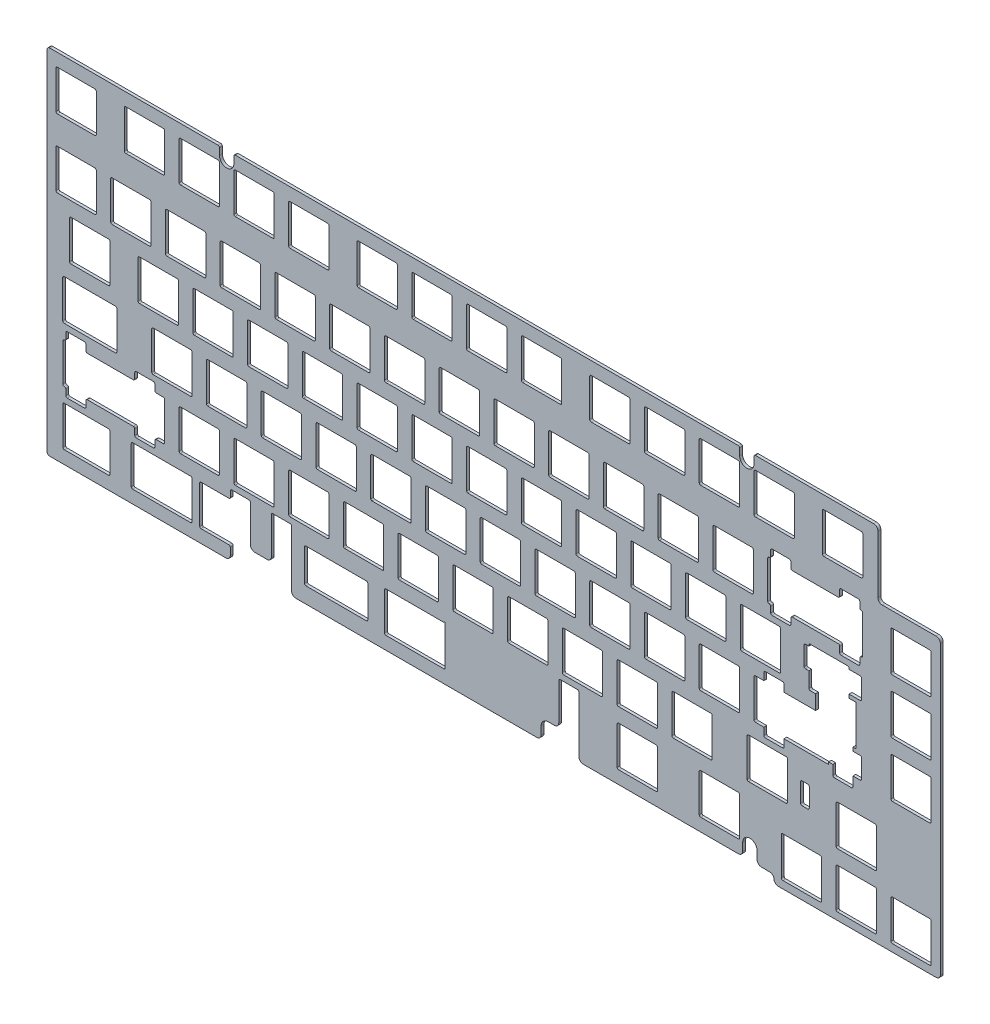
from build123d import *

# Parameters (mm, degrees)
BOSS_EXTRUDE1_DEPTH = 1
CUT_EXTRUDE2_DEPTH  = 1.3
CUT_EXTRUDE1_DEPTH  = 10
FILLET1_R           = 0.5


with BuildPart() as part:
    # Model → Boss-Extrude1 (new body)
    with BuildSketch(Plane.XY):
        with BuildLine():
            ThreePointArc((9.955298424, 130.969514546), (9.177480965, 130.647332005), (8.855298424, 129.869514546))
            Line((8.855298424, 129.869514546), (8.855298424, 63.082014546))
            Line((8.855298424, 63.082014546), (8.855298424, 9.057014546))
            ThreePointArc((8.855298424, 9.057014546), (9.177480965, 8.279197086), (9.955298424, 7.957014546))
            Line((9.955298424, 7.957014546), (71.206983424, 7.957014546))
            ThreePointArc((71.206983424, 7.957014546), (72.267643596, 8.396354374), (72.706983424, 9.457014546))
            Line((72.706983424, 9.457014546), (72.706983424, 11.957014546))
            ThreePointArc((72.706983424, 11.957014546), (72.560536815, 12.310567936), (72.206983424, 12.457014546))
            Line((72.206983424, 12.457014546), (62.559375038, 12.457014546))
            ThreePointArc((62.559375038, 12.457014546), (62.205821647, 12.603461155), (62.059375038, 12.957014546))
            Line((62.059375038, 12.957014546), (62.059375038, 25.957014546))
            ThreePointArc((62.059375038, 25.957014546), (62.205821647, 26.310567936), (62.559375038, 26.457014546))
            Line((62.559375038, 26.457014546), (72.206983424, 26.457014546))
            ThreePointArc((72.206983424, 26.457014546), (72.560536815, 26.603461155), (72.706983424, 26.957014546))
            Line((72.706983424, 26.957014546), (72.706983424, 28.958014546))
            ThreePointArc((72.706983424, 28.958014546), (72.853430033, 29.311567936), (73.206983424, 29.458014546))
            Line((73.206983424, 29.458014546), (79.206983424, 29.458014546))
            ThreePointArc((79.206983424, 29.458014546), (79.560536815, 29.311567936), (79.706983424, 28.958014546))
            Line((79.706983424, 28.958014546), (79.706983424, 16.157014546))
            ThreePointArc((79.706983424, 16.157014546), (80.146323252, 15.096354374), (81.206983424, 14.657014546))
            Line((81.206983424, 14.657014546), (85.495873424, 14.657014546))
            ThreePointArc((85.495873424, 14.657014546), (86.556533596, 15.096354374), (86.995873424, 16.157014546))
            Line((86.995873424, 16.157014546), (86.995873424, 28.958014546))
            ThreePointArc((86.995873424, 28.958014546), (87.142320033, 29.311567936), (87.495873424, 29.458014546))
            Line((87.495873424, 29.458014546), (93.495873424, 29.458014546))
            ThreePointArc((93.495873424, 29.458014546), (93.849426815, 29.311567936), (93.995873424, 28.958014546))
            Line((93.995873424, 28.958014546), (93.995873424, 9.457014546))
            ThreePointArc((93.995873424, 9.457014546), (94.435213252, 8.396354374), (95.495873424, 7.957014546))
            Line((95.495873424, 7.957014546), (179.362538424, 7.957014546))
            ThreePointArc((179.362538424, 7.957014546), (180.423198596, 8.396354374), (180.862538424, 9.457014546))
            Line((180.862538424, 9.457014546), (180.862538424, 12.157014546))
            ThreePointArc((180.862538424, 12.157014546), (181.594771471, 13.924781498), (183.362538424, 14.657014546))
            Line((183.362538424, 14.657014546), (185.495872282, 14.657014546))
            ThreePointArc((185.495872282, 14.657014546), (186.556532454, 15.096354374), (186.995872282, 16.157014546))
            Line((186.995872282, 16.157014546), (186.995872282, 28.958013975))
            ThreePointArc((186.995872282, 28.958013975), (187.14231869, 29.311567734), (187.495872282, 29.458014546))
            Line((187.495872282, 29.458014546), (193.495873424, 29.458014546))
            ThreePointArc((193.495873424, 29.458014546), (193.849426815, 29.311567936), (193.995873424, 28.958014546))
            Line((193.995873424, 28.958014546), (193.995873424, 9.457014546))
            ThreePointArc((193.995873424, 9.457014546), (194.435213252, 8.396354374), (195.495873424, 7.957014546))
            Line((195.495873424, 7.957014546), (249.492798424, 7.957014546))
            ThreePointArc((249.492798424, 7.957014546), (250.553458596, 8.396354374), (250.992798424, 9.457014546))
            Line((250.992798424, 9.457014546), (250.992798424, 12.157014546))
            ThreePointArc((250.992798424, 12.157014546), (253.492798424, 14.657014546), (255.992798424, 12.157014546))
            Line((255.992798424, 12.157014546), (255.992798424, 9.457014546))
            ThreePointArc((255.992798424, 9.457014546), (256.432138252, 8.396354374), (257.492798424, 7.957014546))
            Line((257.492798424, 7.957014546), (260.370951122, 7.957014546))
            ThreePointArc((260.370951122, 7.957014546), (261.407019411, 7.541709203), (261.869374773, 6.525764546))
            ThreePointArc((261.869374773, 6.525764546), (262.331730135, 5.509819888), (263.367798424, 5.094514546))
            Line((263.367798424, 5.094514546), (318.267798424, 5.094514546))
            ThreePointArc((318.267798424, 5.094514546), (319.328458596, 5.533854374), (319.767798424, 6.594514546))
            Line((319.767798424, 6.594514546), (319.767798424, 63.082014546))
            Line((319.767798424, 63.082014546), (319.767798424, 106.45317864))
            ThreePointArc((319.767798424, 106.45317864), (319.328458596, 107.513838812), (318.267798424, 107.95317864))
            Line((318.267798424, 107.95317864), (299.555298424, 107.95317864))
            ThreePointArc((299.555298424, 107.95317864), (298.494638252, 108.392518468), (298.055298424, 109.45317864))
            Line((298.055298424, 109.45317864), (298.055298424, 129.469514546))
            ThreePointArc((298.055298424, 129.469514546), (297.615958596, 130.530174717), (296.555298424, 130.969514546))
            Line((296.555298424, 130.969514546), (256.426800065, 130.969514546))
            Line((256.426800065, 130.969514546), (248.426800065, 130.969514546))
            Line((248.426800065, 130.969514546), (75.451800065, 130.969514546))
            Line((75.451800065, 130.969514546), (67.451800065, 130.969514546))
            Line((67.451800065, 130.969514546), (9.955298424, 130.969514546))
        make_face()
        with BuildLine():
            ThreePointArc((14.934285038, 12.457014546), (14.580731647, 12.603461155), (14.434285038, 12.957014546))
            Line((14.434285038, 12.957014546), (14.434285038, 25.957014546))
            ThreePointArc((14.434285038, 25.957014546), (14.580731647, 26.310567936), (14.934285038, 26.457014546))
            Line((14.934285038, 26.457014546), (30.319483424, 26.457014546))
            ThreePointArc((30.319483424, 26.457014546), (30.673036815, 26.310567936), (30.819483424, 25.957014546))
            Line((30.819483424, 25.957014546), (30.819483424, 12.957014546))
            ThreePointArc((30.819483424, 12.957014546), (30.673036815, 12.603461155), (30.319483424, 12.457014546))
            Line((30.319483424, 12.457014546), (14.934285038, 12.457014546))
        make_face(mode=Mode.SUBTRACT)
        with BuildLine():
            ThreePointArc((38.745375038, 12.457014546), (38.391821647, 12.603461155), (38.245375038, 12.957014546))
            Line((38.245375038, 12.957014546), (38.245375038, 25.957014546))
            ThreePointArc((38.245375038, 25.957014546), (38.391821647, 26.310567936), (38.745375038, 26.457014546))
            Line((38.745375038, 26.457014546), (58.894483424, 26.457014546))
            ThreePointArc((58.894483424, 26.457014546), (59.248036815, 26.310567936), (59.394483424, 25.957014546))
            Line((59.394483424, 25.957014546), (59.394483424, 12.957014546))
            ThreePointArc((59.394483424, 12.957014546), (59.248036815, 12.603461155), (58.894483424, 12.457014546))
            Line((58.894483424, 12.457014546), (38.745375038, 12.457014546))
        make_face(mode=Mode.SUBTRACT)
        with BuildLine():
            Line((120.541283424, 24.957014546), (120.541283424, 13.957014546))
            ThreePointArc((120.541283424, 13.957014546), (120.394836815, 13.603461155), (120.041283424, 13.457014546))
            Line((120.041283424, 13.457014546), (99.041283424, 13.457014546))
            ThreePointArc((99.041283424, 13.457014546), (98.687730033, 13.603461155), (98.541283424, 13.957014546))
            Line((98.541283424, 13.957014546), (98.541283424, 24.957014546))
            ThreePointArc((98.541283424, 24.957014546), (98.687730033, 25.310567936), (99.041283424, 25.457014546))
            Line((99.041283424, 25.457014546), (120.041283424, 25.457014546))
            ThreePointArc((120.041283424, 25.457014546), (120.394836815, 25.310567936), (120.541283424, 24.957014546))
        make_face(mode=Mode.SUBTRACT)
        with BuildLine():
            ThreePointArc((126.856983424, 12.457014546), (126.503430033, 12.603461155), (126.356983424, 12.957014546))
            Line((126.356983424, 12.957014546), (126.356983424, 25.957014546))
            ThreePointArc((126.356983424, 25.957014546), (126.503430033, 26.310567936), (126.856983424, 26.457014546))
            Line((126.856983424, 26.457014546), (146.995875038, 26.457014546))
            ThreePointArc((146.995875038, 26.457014546), (147.192055678, 26.702383251), (147.495875038, 26.782298463))
            Line((147.495875038, 26.782298463), (147.495875038, 12.957014546))
            ThreePointArc((147.495875038, 12.957014546), (147.349428429, 12.603461155), (146.995875038, 12.457014546))
            Line((146.995875038, 12.457014546), (126.856983424, 12.457014546))
        make_face(mode=Mode.SUBTRACT)
        with BuildLine():
            Line((15.463233424, 46.007014546), (15.463233424, 48.007314546))
            ThreePointArc((15.463233424, 48.007314546), (15.609680033, 48.360867936), (15.963233424, 48.507314546))
            Line((15.963233424, 48.507314546), (21.963233424, 48.507314546))
            ThreePointArc((21.963233424, 48.507314546), (22.316786815, 48.360867936), (22.463233424, 48.007314546))
            Line((22.463233424, 48.007314546), (22.463233424, 46.007314546))
            ThreePointArc((22.463233424, 46.007314546), (22.609680033, 45.653761155), (22.963233424, 45.507314546))
            Line((22.963233424, 45.507314546), (38.963233424, 45.507314546))
            ThreePointArc((38.963233424, 45.507314546), (39.316786815, 45.653761155), (39.463233424, 46.007314546))
            Line((39.463233424, 46.007314546), (39.463233424, 48.007314546))
            ThreePointArc((39.463233424, 48.007314546), (39.609680033, 48.360867936), (39.963233424, 48.507314546))
            Line((39.963233424, 48.507314546), (45.963233424, 48.507314546))
            ThreePointArc((45.963233424, 48.507314546), (46.316786815, 48.360867936), (46.463233424, 48.007314546))
            Line((46.463233424, 48.007314546), (46.463233424, 46.007014546))
            ThreePointArc((46.463233424, 46.007014546), (46.609680033, 45.653461155), (46.963233424, 45.507014546))
            Line((46.963233424, 45.507014546), (49.367798424, 45.507014546))
            ThreePointArc((49.367798424, 45.507014546), (49.721351815, 45.360567936), (49.867798424, 45.007014546))
            Line((49.867798424, 45.007014546), (49.867798424, 32.007014546))
            ThreePointArc((49.867798424, 32.007014546), (49.721351815, 31.653461155), (49.367798424, 31.507014546))
            Line((49.367798424, 31.507014546), (46.963233424, 31.507014546))
            ThreePointArc((46.963233424, 31.507014546), (46.609680033, 31.360567936), (46.463233424, 31.007014546))
            Line((46.463233424, 31.007014546), (46.463233424, 29.007314546))
            ThreePointArc((46.463233424, 29.007314546), (46.316786815, 28.653761155), (45.963233424, 28.507314546))
            Line((45.963233424, 28.507314546), (39.963233424, 28.507314546))
            ThreePointArc((39.963233424, 28.507314546), (39.609680033, 28.653761155), (39.463233424, 29.007314546))
            Line((39.463233424, 29.007314546), (39.463233424, 31.007314546))
            ThreePointArc((39.463233424, 31.007314546), (39.316786815, 31.360867936), (38.963233424, 31.507314546))
            Line((38.963233424, 31.507314546), (22.963233424, 31.507314546))
            ThreePointArc((22.963233424, 31.507314546), (22.609680033, 31.360867936), (22.463233424, 31.007314546))
            Line((22.463233424, 31.007314546), (22.463233424, 29.007314546))
            ThreePointArc((22.463233424, 29.007314546), (22.316786815, 28.653761155), (21.963233424, 28.507314546))
            Line((21.963233424, 28.507314546), (15.963233424, 28.507314546))
            ThreePointArc((15.963233424, 28.507314546), (15.609680033, 28.653761155), (15.463233424, 29.007314546))
            Line((15.463233424, 29.007314546), (15.463233424, 31.007014546))
            ThreePointArc((15.463233424, 31.007014546), (15.316786815, 31.360567936), (14.963233424, 31.507014546))
            Line((14.963233424, 31.507014546), (14.936548424, 31.507014546))
            ThreePointArc((14.936548424, 31.507014546), (14.582995033, 31.653461155), (14.436548424, 32.007014546))
            Line((14.436548424, 32.007014546), (14.436548424, 45.007014546))
            ThreePointArc((14.436548424, 45.007014546), (14.582995033, 45.360567936), (14.936548424, 45.507014546))
            Line((14.936548424, 45.507014546), (14.963233424, 45.507014546))
            ThreePointArc((14.963233424, 45.507014546), (15.316786815, 45.653461155), (15.463233424, 46.007014546))
        make_face(mode=Mode.SUBTRACT)
        with BuildLine():
            Line((68.442798424, 31.482014546), (55.392798424, 31.482014546))
            ThreePointArc((55.392798424, 31.482014546), (55.039245033, 31.628461155), (54.892798424, 31.982014546))
            Line((54.892798424, 31.982014546), (54.892798424, 45.032014546))
            ThreePointArc((54.892798424, 45.032014546), (55.039245033, 45.385567936), (55.392798424, 45.532014546))
            Line((55.392798424, 45.532014546), (68.442798424, 45.532014546))
            ThreePointArc((68.442798424, 45.532014546), (68.796351815, 45.385567936), (68.942798424, 45.032014546))
            Line((68.942798424, 45.032014546), (68.942798424, 31.982014546))
            ThreePointArc((68.942798424, 31.982014546), (68.796351815, 31.628461155), (68.442798424, 31.482014546))
        make_face(mode=Mode.SUBTRACT)
        with BuildLine():
            Line((87.492798424, 31.482014546), (74.442798424, 31.482014546))
            ThreePointArc((74.442798424, 31.482014546), (74.089245033, 31.628461155), (73.942798424, 31.982014546))
            Line((73.942798424, 31.982014546), (73.942798424, 45.032014546))
            ThreePointArc((73.942798424, 45.032014546), (74.089245033, 45.385567936), (74.442798424, 45.532014546))
            Line((74.442798424, 45.532014546), (87.492798424, 45.532014546))
            ThreePointArc((87.492798424, 45.532014546), (87.846351815, 45.385567936), (87.992798424, 45.032014546))
            Line((87.992798424, 45.032014546), (87.992798424, 31.982014546))
            ThreePointArc((87.992798424, 31.982014546), (87.846351815, 31.628461155), (87.492798424, 31.482014546))
        make_face(mode=Mode.SUBTRACT)
        with BuildLine():
            ThreePointArc((33.249048424, 51.057014546), (33.087957154, 50.668105816), (32.699048424, 50.507014546))
            Line((32.699048424, 50.507014546), (14.936548424, 50.507014546))
            ThreePointArc((14.936548424, 50.507014546), (14.547639694, 50.668105816), (14.386548424, 51.057014546))
            Line((14.386548424, 51.057014546), (14.386548424, 64.057014546))
            ThreePointArc((14.386548424, 64.057014546), (14.547639694, 64.445923275), (14.936548424, 64.607014546))
            Line((14.936548424, 64.607014546), (32.699048424, 64.607014546))
            ThreePointArc((32.699048424, 64.607014546), (33.087957154, 64.445923275), (33.249048424, 64.057014546))
            Line((33.249048424, 64.057014546), (33.249048424, 51.057014546))
        make_face(mode=Mode.SUBTRACT)
        with BuildLine():
            Line((58.917798424, 50.532014546), (45.867798424, 50.532014546))
            ThreePointArc((45.867798424, 50.532014546), (45.514245033, 50.678461155), (45.367798424, 51.032014546))
            Line((45.367798424, 51.032014546), (45.367798424, 64.082014546))
            ThreePointArc((45.367798424, 64.082014546), (45.514245033, 64.435567936), (45.867798424, 64.582014546))
            Line((45.867798424, 64.582014546), (58.917798424, 64.582014546))
            ThreePointArc((58.917798424, 64.582014546), (59.271351815, 64.435567936), (59.417798424, 64.082014546))
            Line((59.417798424, 64.082014546), (59.417798424, 51.032014546))
            ThreePointArc((59.417798424, 51.032014546), (59.271351815, 50.678461155), (58.917798424, 50.532014546))
        make_face(mode=Mode.SUBTRACT)
        with BuildLine():
            Line((77.967798424, 50.532014546), (64.917798424, 50.532014546))
            ThreePointArc((64.917798424, 50.532014546), (64.564245033, 50.678461155), (64.417798424, 51.032014546))
            Line((64.417798424, 51.032014546), (64.417798424, 64.082014546))
            ThreePointArc((64.417798424, 64.082014546), (64.564245033, 64.435567936), (64.917798424, 64.582014546))
            Line((64.917798424, 64.582014546), (77.967798424, 64.582014546))
            ThreePointArc((77.967798424, 64.582014546), (78.321351815, 64.435567936), (78.467798424, 64.082014546))
            Line((78.467798424, 64.082014546), (78.467798424, 51.032014546))
            ThreePointArc((78.467798424, 51.032014546), (78.321351815, 50.678461155), (77.967798424, 50.532014546))
        make_face(mode=Mode.SUBTRACT)
        with BuildLine():
            Line((106.542798424, 31.482014546), (93.492798424, 31.482014546))
            ThreePointArc((93.492798424, 31.482014546), (93.139245033, 31.628461155), (92.992798424, 31.982014546))
            Line((92.992798424, 31.982014546), (92.992798424, 45.032014546))
            ThreePointArc((92.992798424, 45.032014546), (93.139245033, 45.385567936), (93.492798424, 45.532014546))
            Line((93.492798424, 45.532014546), (106.542798424, 45.532014546))
            ThreePointArc((106.542798424, 45.532014546), (106.896351815, 45.385567936), (107.042798424, 45.032014546))
            Line((107.042798424, 45.032014546), (107.042798424, 31.982014546))
            ThreePointArc((107.042798424, 31.982014546), (106.896351815, 31.628461155), (106.542798424, 31.482014546))
        make_face(mode=Mode.SUBTRACT)
        with BuildLine():
            Line((125.592798424, 31.482014546), (112.542798424, 31.482014546))
            ThreePointArc((112.542798424, 31.482014546), (112.189245033, 31.628461155), (112.042798424, 31.982014546))
            Line((112.042798424, 31.982014546), (112.042798424, 45.032014546))
            ThreePointArc((112.042798424, 45.032014546), (112.189245033, 45.385567936), (112.542798424, 45.532014546))
            Line((112.542798424, 45.532014546), (125.592798424, 45.532014546))
            ThreePointArc((125.592798424, 45.532014546), (125.946351815, 45.385567936), (126.092798424, 45.032014546))
            Line((126.092798424, 45.032014546), (126.092798424, 31.982014546))
            ThreePointArc((126.092798424, 31.982014546), (125.946351815, 31.628461155), (125.592798424, 31.482014546))
        make_face(mode=Mode.SUBTRACT)
        with BuildLine():
            Line((144.642798424, 31.482014546), (131.592798424, 31.482014546))
            ThreePointArc((131.592798424, 31.482014546), (131.239245033, 31.628461155), (131.092798424, 31.982014546))
            Line((131.092798424, 31.982014546), (131.092798424, 45.032014546))
            ThreePointArc((131.092798424, 45.032014546), (131.239245033, 45.385567936), (131.592798424, 45.532014546))
            Line((131.592798424, 45.532014546), (144.642798424, 45.532014546))
            ThreePointArc((144.642798424, 45.532014546), (144.996351815, 45.385567936), (145.142798424, 45.032014546))
            Line((145.142798424, 45.032014546), (145.142798424, 31.982014546))
            ThreePointArc((145.142798424, 31.982014546), (144.996351815, 31.628461155), (144.642798424, 31.482014546))
        make_face(mode=Mode.SUBTRACT)
        with BuildLine():
            Line((163.692798424, 31.482014546), (150.642798424, 31.482014546))
            ThreePointArc((150.642798424, 31.482014546), (150.289245033, 31.628461155), (150.142798424, 31.982014546))
            Line((150.142798424, 31.982014546), (150.142798424, 45.032014546))
            ThreePointArc((150.142798424, 45.032014546), (150.289245033, 45.385567936), (150.642798424, 45.532014546))
            Line((150.642798424, 45.532014546), (163.692798424, 45.532014546))
            ThreePointArc((163.692798424, 45.532014546), (164.046351815, 45.385567936), (164.192798424, 45.032014546))
            Line((164.192798424, 45.032014546), (164.192798424, 31.982014546))
            ThreePointArc((164.192798424, 31.982014546), (164.046351815, 31.628461155), (163.692798424, 31.482014546))
        make_face(mode=Mode.SUBTRACT)
        with BuildLine():
            Line((97.017798424, 50.532014546), (83.967798424, 50.532014546))
            ThreePointArc((83.967798424, 50.532014546), (83.614245033, 50.678461155), (83.467798424, 51.032014546))
            Line((83.467798424, 51.032014546), (83.467798424, 64.082014546))
            ThreePointArc((83.467798424, 64.082014546), (83.614245033, 64.435567936), (83.967798424, 64.582014546))
            Line((83.967798424, 64.582014546), (97.017798424, 64.582014546))
            ThreePointArc((97.017798424, 64.582014546), (97.371351815, 64.435567936), (97.517798424, 64.082014546))
            Line((97.517798424, 64.082014546), (97.517798424, 51.032014546))
            ThreePointArc((97.517798424, 51.032014546), (97.371351815, 50.678461155), (97.017798424, 50.532014546))
        make_face(mode=Mode.SUBTRACT)
        with BuildLine():
            Line((116.067798424, 50.532014546), (103.017798424, 50.532014546))
            ThreePointArc((103.017798424, 50.532014546), (102.664245033, 50.678461155), (102.517798424, 51.032014546))
            Line((102.517798424, 51.032014546), (102.517798424, 64.082014546))
            ThreePointArc((102.517798424, 64.082014546), (102.664245033, 64.435567936), (103.017798424, 64.582014546))
            Line((103.017798424, 64.582014546), (116.067798424, 64.582014546))
            ThreePointArc((116.067798424, 64.582014546), (116.421351815, 64.435567936), (116.567798424, 64.082014546))
            Line((116.567798424, 64.082014546), (116.567798424, 51.032014546))
            ThreePointArc((116.567798424, 51.032014546), (116.421351815, 50.678461155), (116.067798424, 50.532014546))
        make_face(mode=Mode.SUBTRACT)
        with BuildLine():
            Line((135.117798424, 50.532014546), (122.067798424, 50.532014546))
            ThreePointArc((122.067798424, 50.532014546), (121.714245033, 50.678461155), (121.567798424, 51.032014546))
            Line((121.567798424, 51.032014546), (121.567798424, 64.082014546))
            ThreePointArc((121.567798424, 64.082014546), (121.714245033, 64.435567936), (122.067798424, 64.582014546))
            Line((122.067798424, 64.582014546), (135.117798424, 64.582014546))
            ThreePointArc((135.117798424, 64.582014546), (135.471351815, 64.435567936), (135.617798424, 64.082014546))
            Line((135.617798424, 64.082014546), (135.617798424, 51.032014546))
            ThreePointArc((135.617798424, 51.032014546), (135.471351815, 50.678461155), (135.117798424, 50.532014546))
        make_face(mode=Mode.SUBTRACT)
        with BuildLine():
            Line((154.167798424, 50.532014546), (141.117798424, 50.532014546))
            ThreePointArc((141.117798424, 50.532014546), (140.764245033, 50.678461155), (140.617798424, 51.032014546))
            Line((140.617798424, 51.032014546), (140.617798424, 64.082014546))
            ThreePointArc((140.617798424, 64.082014546), (140.764245033, 64.435567936), (141.117798424, 64.582014546))
            Line((141.117798424, 64.582014546), (154.167798424, 64.582014546))
            ThreePointArc((154.167798424, 64.582014546), (154.521351815, 64.435567936), (154.667798424, 64.082014546))
            Line((154.667798424, 64.082014546), (154.667798424, 51.032014546))
            ThreePointArc((154.667798424, 51.032014546), (154.521351815, 50.678461155), (154.167798424, 50.532014546))
        make_face(mode=Mode.SUBTRACT)
        with BuildLine():
            Line((220.842798424, 12.432014546), (207.792798424, 12.432014546))
            ThreePointArc((207.792798424, 12.432014546), (207.439245033, 12.578461155), (207.292798424, 12.932014546))
            Line((207.292798424, 12.932014546), (207.292798424, 25.982014546))
            ThreePointArc((207.292798424, 25.982014546), (207.439245033, 26.335567936), (207.792798424, 26.482014546))
            Line((207.792798424, 26.482014546), (220.842798424, 26.482014546))
            ThreePointArc((220.842798424, 26.482014546), (221.196351815, 26.335567936), (221.342798424, 25.982014546))
            Line((221.342798424, 25.982014546), (221.342798424, 12.932014546))
            ThreePointArc((221.342798424, 12.932014546), (221.196351815, 12.578461155), (220.842798424, 12.432014546))
        make_face(mode=Mode.SUBTRACT)
        with BuildLine():
            Line((249.417798424, 12.432014546), (236.367798424, 12.432014546))
            ThreePointArc((236.367798424, 12.432014546), (236.014245033, 12.578461155), (235.867798424, 12.932014546))
            Line((235.867798424, 12.932014546), (235.867798424, 25.982014546))
            ThreePointArc((235.867798424, 25.982014546), (236.014245033, 26.335567936), (236.367798424, 26.482014546))
            Line((236.367798424, 26.482014546), (249.417798424, 26.482014546))
            ThreePointArc((249.417798424, 26.482014546), (249.771351815, 26.335567936), (249.917798424, 25.982014546))
            Line((249.917798424, 25.982014546), (249.917798424, 12.932014546))
            ThreePointArc((249.917798424, 12.932014546), (249.771351815, 12.578461155), (249.417798424, 12.432014546))
        make_face(mode=Mode.SUBTRACT)
        with BuildLine():
            Line((277.992798424, 7.669514546), (264.942798424, 7.669514546))
            ThreePointArc((264.942798424, 7.669514546), (264.589245033, 7.815961155), (264.442798424, 8.169514546))
            Line((264.442798424, 8.169514546), (264.442798424, 21.219514546))
            ThreePointArc((264.442798424, 21.219514546), (264.589245033, 21.573067936), (264.942798424, 21.719514546))
            Line((264.942798424, 21.719514546), (277.992798424, 21.719514546))
            ThreePointArc((277.992798424, 21.719514546), (278.346351815, 21.573067936), (278.492798424, 21.219514546))
            Line((278.492798424, 21.219514546), (278.492798424, 8.169514546))
            ThreePointArc((278.492798424, 8.169514546), (278.346351815, 7.815961155), (277.992798424, 7.669514546))
        make_face(mode=Mode.SUBTRACT)
        with BuildLine():
            Line((297.042798424, 7.669514546), (283.992798424, 7.669514546))
            ThreePointArc((283.992798424, 7.669514546), (283.639245033, 7.815961155), (283.492798424, 8.169514546))
            Line((283.492798424, 8.169514546), (283.492798424, 21.219514546))
            ThreePointArc((283.492798424, 21.219514546), (283.639245033, 21.573067936), (283.992798424, 21.719514546))
            Line((283.992798424, 21.719514546), (297.042798424, 21.719514546))
            ThreePointArc((297.042798424, 21.719514546), (297.396351815, 21.573067936), (297.542798424, 21.219514546))
            Line((297.542798424, 21.219514546), (297.542798424, 8.169514546))
            ThreePointArc((297.542798424, 8.169514546), (297.396351815, 7.815961155), (297.042798424, 7.669514546))
        make_face(mode=Mode.SUBTRACT)
        with BuildLine():
            Line((316.092798424, 7.669514546), (303.042798424, 7.669514546))
            ThreePointArc((303.042798424, 7.669514546), (302.689245033, 7.815961155), (302.542798424, 8.169514546))
            Line((302.542798424, 8.169514546), (302.542798424, 21.219514546))
            ThreePointArc((302.542798424, 21.219514546), (302.689245033, 21.573067936), (303.042798424, 21.719514546))
            Line((303.042798424, 21.719514546), (316.092798424, 21.719514546))
            ThreePointArc((316.092798424, 21.719514546), (316.446351815, 21.573067936), (316.592798424, 21.219514546))
            Line((316.592798424, 21.219514546), (316.592798424, 8.169514546))
            ThreePointArc((316.592798424, 8.169514546), (316.446351815, 7.815961155), (316.092798424, 7.669514546))
        make_face(mode=Mode.SUBTRACT)
        with BuildLine():
            Line((297.042798424, 26.719514546), (283.992798424, 26.719514546))
            ThreePointArc((283.992798424, 26.719514546), (283.639245033, 26.865961155), (283.492798424, 27.219514546))
            Line((283.492798424, 27.219514546), (283.492798424, 40.269514546))
            ThreePointArc((283.492798424, 40.269514546), (283.639245033, 40.623067936), (283.992798424, 40.769514546))
            Line((283.992798424, 40.769514546), (297.042798424, 40.769514546))
            ThreePointArc((297.042798424, 40.769514546), (297.396351815, 40.623067936), (297.542798424, 40.269514546))
            Line((297.542798424, 40.269514546), (297.542798424, 27.219514546))
            ThreePointArc((297.542798424, 27.219514546), (297.396351815, 26.865961155), (297.042798424, 26.719514546))
        make_face(mode=Mode.SUBTRACT)
        with BuildLine():
            Line((182.742798424, 31.482014546), (169.692798424, 31.482014546))
            ThreePointArc((169.692798424, 31.482014546), (169.339245033, 31.628461155), (169.192798424, 31.982014546))
            Line((169.192798424, 31.982014546), (169.192798424, 45.032014546))
            ThreePointArc((169.192798424, 45.032014546), (169.339245033, 45.385567936), (169.692798424, 45.532014546))
            Line((169.692798424, 45.532014546), (182.742798424, 45.532014546))
            ThreePointArc((182.742798424, 45.532014546), (183.096351815, 45.385567936), (183.242798424, 45.032014546))
            Line((183.242798424, 45.032014546), (183.242798424, 31.982014546))
            ThreePointArc((183.242798424, 31.982014546), (183.096351815, 31.628461155), (182.742798424, 31.482014546))
        make_face(mode=Mode.SUBTRACT)
        with BuildLine():
            Line((201.792798424, 31.482014546), (188.742798424, 31.482014546))
            ThreePointArc((188.742798424, 31.482014546), (188.389245033, 31.628461155), (188.242798424, 31.982014546))
            Line((188.242798424, 31.982014546), (188.242798424, 45.032014546))
            ThreePointArc((188.242798424, 45.032014546), (188.389245033, 45.385567936), (188.742798424, 45.532014546))
            Line((188.742798424, 45.532014546), (201.792798424, 45.532014546))
            ThreePointArc((201.792798424, 45.532014546), (202.146351815, 45.385567936), (202.292798424, 45.032014546))
            Line((202.292798424, 45.032014546), (202.292798424, 31.982014546))
            ThreePointArc((202.292798424, 31.982014546), (202.146351815, 31.628461155), (201.792798424, 31.482014546))
        make_face(mode=Mode.SUBTRACT)
        with BuildLine():
            Line((220.842798424, 31.482014546), (207.792798424, 31.482014546))
            ThreePointArc((207.792798424, 31.482014546), (207.439245033, 31.628461155), (207.292798424, 31.982014546))
            Line((207.292798424, 31.982014546), (207.292798424, 45.032014546))
            ThreePointArc((207.292798424, 45.032014546), (207.439245033, 45.385567936), (207.792798424, 45.532014546))
            Line((207.792798424, 45.532014546), (220.842798424, 45.532014546))
            ThreePointArc((220.842798424, 45.532014546), (221.196351815, 45.385567936), (221.342798424, 45.032014546))
            Line((221.342798424, 45.032014546), (221.342798424, 31.982014546))
            ThreePointArc((221.342798424, 31.982014546), (221.196351815, 31.628461155), (220.842798424, 31.482014546))
        make_face(mode=Mode.SUBTRACT)
        with BuildLine():
            Line((239.892798424, 31.482014546), (226.842798424, 31.482014546))
            ThreePointArc((226.842798424, 31.482014546), (226.489245033, 31.628461155), (226.342798424, 31.982014546))
            Line((226.342798424, 31.982014546), (226.342798424, 45.032014546))
            ThreePointArc((226.342798424, 45.032014546), (226.489245033, 45.385567936), (226.842798424, 45.532014546))
            Line((226.842798424, 45.532014546), (239.892798424, 45.532014546))
            ThreePointArc((239.892798424, 45.532014546), (240.246351815, 45.385567936), (240.392798424, 45.032014546))
            Line((240.392798424, 45.032014546), (240.392798424, 31.982014546))
            ThreePointArc((240.392798424, 31.982014546), (240.246351815, 31.628461155), (239.892798424, 31.482014546))
        make_face(mode=Mode.SUBTRACT)
        with BuildLine():
            Line((173.217798424, 50.532014546), (160.167798424, 50.532014546))
            ThreePointArc((160.167798424, 50.532014546), (159.814245033, 50.678461155), (159.667798424, 51.032014546))
            Line((159.667798424, 51.032014546), (159.667798424, 64.082014546))
            ThreePointArc((159.667798424, 64.082014546), (159.814245033, 64.435567936), (160.167798424, 64.582014546))
            Line((160.167798424, 64.582014546), (173.217798424, 64.582014546))
            ThreePointArc((173.217798424, 64.582014546), (173.571351815, 64.435567936), (173.717798424, 64.082014546))
            Line((173.717798424, 64.082014546), (173.717798424, 51.032014546))
            ThreePointArc((173.717798424, 51.032014546), (173.571351815, 50.678461155), (173.217798424, 50.532014546))
        make_face(mode=Mode.SUBTRACT)
        with BuildLine():
            Line((192.267798424, 50.532014546), (179.217798424, 50.532014546))
            ThreePointArc((179.217798424, 50.532014546), (178.864245033, 50.678461155), (178.717798424, 51.032014546))
            Line((178.717798424, 51.032014546), (178.717798424, 64.082014546))
            ThreePointArc((178.717798424, 64.082014546), (178.864245033, 64.435567936), (179.217798424, 64.582014546))
            Line((179.217798424, 64.582014546), (192.267798424, 64.582014546))
            ThreePointArc((192.267798424, 64.582014546), (192.621351815, 64.435567936), (192.767798424, 64.082014546))
            Line((192.767798424, 64.082014546), (192.767798424, 51.032014546))
            ThreePointArc((192.767798424, 51.032014546), (192.621351815, 50.678461155), (192.267798424, 50.532014546))
        make_face(mode=Mode.SUBTRACT)
        with BuildLine():
            Line((211.317798424, 50.532014546), (198.267798424, 50.532014546))
            ThreePointArc((198.267798424, 50.532014546), (197.914245033, 50.678461155), (197.767798424, 51.032014546))
            Line((197.767798424, 51.032014546), (197.767798424, 64.082014546))
            ThreePointArc((197.767798424, 64.082014546), (197.914245033, 64.435567936), (198.267798424, 64.582014546))
            Line((198.267798424, 64.582014546), (211.317798424, 64.582014546))
            ThreePointArc((211.317798424, 64.582014546), (211.671351815, 64.435567936), (211.817798424, 64.082014546))
            Line((211.817798424, 64.082014546), (211.817798424, 51.032014546))
            ThreePointArc((211.817798424, 51.032014546), (211.671351815, 50.678461155), (211.317798424, 50.532014546))
        make_face(mode=Mode.SUBTRACT)
        with BuildLine():
            Line((230.367798424, 50.532014546), (217.317798424, 50.532014546))
            ThreePointArc((217.317798424, 50.532014546), (216.964245033, 50.678461155), (216.817798424, 51.032014546))
            Line((216.817798424, 51.032014546), (216.817798424, 64.082014546))
            ThreePointArc((216.817798424, 64.082014546), (216.964245033, 64.435567936), (217.317798424, 64.582014546))
            Line((217.317798424, 64.582014546), (230.367798424, 64.582014546))
            ThreePointArc((230.367798424, 64.582014546), (230.721351815, 64.435567936), (230.867798424, 64.082014546))
            Line((230.867798424, 64.082014546), (230.867798424, 51.032014546))
            ThreePointArc((230.867798424, 51.032014546), (230.721351815, 50.678461155), (230.367798424, 50.532014546))
        make_face(mode=Mode.SUBTRACT)
        with BuildLine():
            Line((266.086548424, 31.482014546), (253.036548424, 31.482014546))
            ThreePointArc((253.036548424, 31.482014546), (252.682995033, 31.628461155), (252.536548424, 31.982014546))
            Line((252.536548424, 31.982014546), (252.536548424, 45.032014546))
            ThreePointArc((252.536548424, 45.032014546), (252.682995033, 45.385567936), (253.036548424, 45.532014546))
            Line((253.036548424, 45.532014546), (266.086548424, 45.532014546))
            ThreePointArc((266.086548424, 45.532014546), (266.440101815, 45.385567936), (266.586548424, 45.032014546))
            Line((266.586548424, 45.032014546), (266.586548424, 31.982014546))
            ThreePointArc((266.586548424, 31.982014546), (266.440101815, 31.628461155), (266.086548424, 31.482014546))
        make_face(mode=Mode.SUBTRACT)
        with BuildLine():
            ThreePointArc((271.157173424, 40.507014546), (271.303620033, 40.860567936), (271.657173424, 41.007014546))
            Line((271.657173424, 41.007014546), (273.657173424, 41.007014546))
            ThreePointArc((273.657173424, 41.007014546), (274.010726815, 40.860567936), (274.157173424, 40.507014546))
            Line((274.157173424, 40.507014546), (274.157173424, 36.507014546))
            ThreePointArc((274.157173424, 36.507014546), (274.010726815, 36.153461155), (273.657173424, 36.007014546))
            Line((273.657173424, 36.007014546), (271.657173424, 36.007014546))
            ThreePointArc((271.657173424, 36.007014546), (271.303620033, 36.153461155), (271.157173424, 36.507014546))
            Line((271.157173424, 36.507014546), (271.157173424, 40.507014546))
        make_face(mode=Mode.SUBTRACT)
        with BuildLine():
            Line((249.417798424, 50.532014546), (236.367798424, 50.532014546))
            ThreePointArc((236.367798424, 50.532014546), (236.014245033, 50.678461155), (235.867798424, 51.032014546))
            Line((235.867798424, 51.032014546), (235.867798424, 64.082014546))
            ThreePointArc((235.867798424, 64.082014546), (236.014245033, 64.435567936), (236.367798424, 64.582014546))
            Line((236.367798424, 64.582014546), (249.417798424, 64.582014546))
            ThreePointArc((249.417798424, 64.582014546), (249.771351815, 64.435567936), (249.917798424, 64.082014546))
            Line((249.917798424, 64.082014546), (249.917798424, 51.032014546))
            ThreePointArc((249.917798424, 51.032014546), (249.771351815, 50.678461155), (249.417798424, 50.532014546))
        make_face(mode=Mode.SUBTRACT)
        with BuildLine():
            ThreePointArc((273.992798424, 83.107014546), (274.139245033, 83.460567936), (274.492798424, 83.607014546))
            Line((274.492798424, 83.607014546), (287.492798424, 83.607014546))
            ThreePointArc((287.492798424, 83.607014546), (287.846351815, 83.460567936), (287.992798424, 83.107014546))
            Line((287.992798424, 83.107014546), (287.995298424, 82.780068193))
            Line((287.995298424, 82.780068193), (291.850783424, 82.780068193))
            ThreePointArc((291.850783424, 82.780068193), (292.204336815, 82.633621584), (292.350783424, 82.280068193))
            Line((292.350783424, 82.280068193), (292.350783424, 75.842068193))
            ThreePointArc((292.350783424, 75.842068193), (292.204336815, 75.488514803), (291.850783424, 75.342068193))
            Line((291.850783424, 75.342068193), (287.995298424, 75.342068193))
            Line((287.995298424, 75.342068193), (287.995298424, 74.061068193))
            Line((287.995298424, 74.061068193), (290.376548424, 74.061068193))
            Line((290.376548424, 74.061068193), (290.376548424, 60.061068193))
            Line((290.376548424, 60.061068193), (289.350783424, 60.061068193))
            Line((289.350783424, 60.061068193), (289.350783424, 58.780068193))
            Line((289.350783424, 58.780068193), (291.850783424, 58.780068193))
            ThreePointArc((291.850783424, 58.780068193), (292.204336815, 58.633621584), (292.350783424, 58.280068193))
            Line((292.350783424, 58.280068193), (292.350783424, 51.842068193))
            ThreePointArc((292.350783424, 51.842068193), (292.204336815, 51.488514803), (291.850783424, 51.342068193))
            Line((291.850783424, 51.342068193), (289.350783424, 51.342068193))
            Line((289.350783424, 51.342068193), (289.350783424, 48.057014546))
            ThreePointArc((289.350783424, 48.057014546), (289.204336815, 47.703461155), (288.850783424, 47.557014546))
            Line((288.850783424, 47.557014546), (282.850783424, 47.557014546))
            ThreePointArc((282.850783424, 47.557014546), (282.497230033, 47.703461155), (282.350783424, 48.057014546))
            Line((282.350783424, 48.057014546), (282.350783424, 51.342068193))
            Line((282.350783424, 51.342068193), (280.851598424, 51.342068193))
            Line((280.851598424, 51.342068193), (280.851598424, 50.557014546))
            Line((280.851598424, 50.557014546), (265.350783424, 50.557014546))
            Line((265.350783424, 50.557014546), (265.350783424, 48.057014546))
            ThreePointArc((265.350783424, 48.057014546), (265.204336815, 47.703461155), (264.850783424, 47.557014546))
            Line((264.850783424, 47.557014546), (258.850783424, 47.557014546))
            ThreePointArc((258.850783424, 47.557014546), (258.497230033, 47.703461155), (258.350783424, 48.057014546))
            Line((258.350783424, 48.057014546), (258.350783424, 50.557014546))
            Line((258.350783424, 50.557014546), (255.445298424, 50.557014546))
            ThreePointArc((255.445298424, 50.557014546), (255.091745033, 50.703461155), (254.945298424, 51.057014546))
            Line((254.945298424, 51.057014546), (254.945298424, 64.057014546))
            ThreePointArc((254.945298424, 64.057014546), (255.091745033, 64.410567936), (255.445298424, 64.557014546))
            Line((255.445298424, 64.557014546), (258.350783424, 64.557014546))
            Line((258.350783424, 64.557014546), (258.350783424, 67.057014546))
            ThreePointArc((258.350783424, 67.057014546), (258.497230033, 67.410567936), (258.850783424, 67.557014546))
            Line((258.850783424, 67.557014546), (264.850783424, 67.557014546))
            ThreePointArc((264.850783424, 67.557014546), (265.204336815, 67.410567936), (265.350783424, 67.057014546))
            Line((265.350783424, 67.057014546), (265.350783424, 64.557014546))
            Line((265.350783424, 64.557014546), (276.376548424, 64.557014546))
            Line((276.376548424, 64.557014546), (276.376548424, 69.607014546))
            Line((276.376548424, 69.607014546), (274.492798424, 69.607014546))
            ThreePointArc((274.492798424, 69.607014546), (274.139245033, 69.753461155), (273.992798424, 70.107014546))
            Line((273.992798424, 70.107014546), (273.992798424, 75.342068193))
            Line((273.992798424, 75.342068193), (272.850783424, 75.342068193))
            ThreePointArc((272.850783424, 75.342068193), (272.497230033, 75.488514803), (272.350783424, 75.842068193))
            Line((272.350783424, 75.842068193), (272.350783424, 82.280068193))
            ThreePointArc((272.350783424, 82.280068193), (272.497230033, 82.633621584), (272.850783424, 82.780068193))
            Line((272.850783424, 82.780068193), (273.992798424, 82.780068193))
            Line((273.992798424, 82.780068193), (273.992798424, 83.107014546))
        make_face(mode=Mode.SUBTRACT)
        with BuildLine():
            ThreePointArc((302.542798424, 64.057014546), (302.696567364, 64.428245606), (303.067798424, 64.582014546))
            Line((303.067798424, 64.582014546), (316.117798424, 64.582014546))
            ThreePointArc((316.117798424, 64.582014546), (316.453674145, 64.442890267), (316.592798424, 64.107014546))
            Line((316.592798424, 64.107014546), (316.592798424, 51.057014546))
            ThreePointArc((316.592798424, 51.057014546), (316.439029484, 50.685783485), (316.067798424, 50.532014546))
            Line((316.067798424, 50.532014546), (303.067798424, 50.532014546))
            ThreePointArc((303.067798424, 50.532014546), (302.696567364, 50.685783485), (302.542798424, 51.057014546))
            Line((302.542798424, 51.057014546), (302.542798424, 64.057014546))
        make_face(mode=Mode.SUBTRACT)
        with BuildLine():
            Line((30.342798424, 69.582014546), (17.292798424, 69.582014546))
            ThreePointArc((17.292798424, 69.582014546), (16.939245033, 69.728461155), (16.792798424, 70.082014546))
            Line((16.792798424, 70.082014546), (16.792798424, 83.132014546))
            ThreePointArc((16.792798424, 83.132014546), (16.939245033, 83.485567936), (17.292798424, 83.632014546))
            Line((17.292798424, 83.632014546), (30.342798424, 83.632014546))
            ThreePointArc((30.342798424, 83.632014546), (30.696351815, 83.485567936), (30.842798424, 83.132014546))
            Line((30.842798424, 83.132014546), (30.842798424, 70.082014546))
            ThreePointArc((30.842798424, 70.082014546), (30.696351815, 69.728461155), (30.342798424, 69.582014546))
        make_face(mode=Mode.SUBTRACT)
        with BuildLine():
            Line((54.155298424, 69.582014546), (41.105298424, 69.582014546))
            ThreePointArc((41.105298424, 69.582014546), (40.751745033, 69.728461155), (40.605298424, 70.082014546))
            Line((40.605298424, 70.082014546), (40.605298424, 83.132014546))
            ThreePointArc((40.605298424, 83.132014546), (40.751745033, 83.485567936), (41.105298424, 83.632014546))
            Line((41.105298424, 83.632014546), (54.155298424, 83.632014546))
            ThreePointArc((54.155298424, 83.632014546), (54.508851815, 83.485567936), (54.655298424, 83.132014546))
            Line((54.655298424, 83.132014546), (54.655298424, 70.082014546))
            ThreePointArc((54.655298424, 70.082014546), (54.508851815, 69.728461155), (54.155298424, 69.582014546))
        make_face(mode=Mode.SUBTRACT)
        with BuildLine():
            Line((73.205298424, 69.582014546), (60.155298424, 69.582014546))
            ThreePointArc((60.155298424, 69.582014546), (59.801745033, 69.728461155), (59.655298424, 70.082014546))
            Line((59.655298424, 70.082014546), (59.655298424, 83.132014546))
            ThreePointArc((59.655298424, 83.132014546), (59.801745033, 83.485567936), (60.155298424, 83.632014546))
            Line((60.155298424, 83.632014546), (73.205298424, 83.632014546))
            ThreePointArc((73.205298424, 83.632014546), (73.558851815, 83.485567936), (73.705298424, 83.132014546))
            Line((73.705298424, 83.132014546), (73.705298424, 70.082014546))
            ThreePointArc((73.705298424, 70.082014546), (73.558851815, 69.728461155), (73.205298424, 69.582014546))
        make_face(mode=Mode.SUBTRACT)
        with BuildLine():
            Line((92.255298424, 69.582014546), (79.205298424, 69.582014546))
            ThreePointArc((79.205298424, 69.582014546), (78.851745033, 69.728461155), (78.705298424, 70.082014546))
            Line((78.705298424, 70.082014546), (78.705298424, 83.132014546))
            ThreePointArc((78.705298424, 83.132014546), (78.851745033, 83.485567936), (79.205298424, 83.632014546))
            Line((79.205298424, 83.632014546), (92.255298424, 83.632014546))
            ThreePointArc((92.255298424, 83.632014546), (92.608851815, 83.485567936), (92.755298424, 83.132014546))
            Line((92.755298424, 83.132014546), (92.755298424, 70.082014546))
            ThreePointArc((92.755298424, 70.082014546), (92.608851815, 69.728461155), (92.255298424, 69.582014546))
        make_face(mode=Mode.SUBTRACT)
        with BuildLine():
            Line((25.580298424, 88.632014546), (12.530298424, 88.632014546))
            ThreePointArc((12.530298424, 88.632014546), (12.176745033, 88.778461155), (12.030298424, 89.132014546))
            Line((12.030298424, 89.132014546), (12.030298424, 102.182014546))
            ThreePointArc((12.030298424, 102.182014546), (12.176745033, 102.535567936), (12.530298424, 102.682014546))
            Line((12.530298424, 102.682014546), (25.580298424, 102.682014546))
            ThreePointArc((25.580298424, 102.682014546), (25.933851815, 102.535567936), (26.080298424, 102.182014546))
            Line((26.080298424, 102.182014546), (26.080298424, 89.132014546))
            ThreePointArc((26.080298424, 89.132014546), (25.933851815, 88.778461155), (25.580298424, 88.632014546))
        make_face(mode=Mode.SUBTRACT)
        with BuildLine():
            Line((44.630298424, 88.632014546), (31.580298424, 88.632014546))
            ThreePointArc((31.580298424, 88.632014546), (31.226745033, 88.778461155), (31.080298424, 89.132014546))
            Line((31.080298424, 89.132014546), (31.080298424, 102.182014546))
            ThreePointArc((31.080298424, 102.182014546), (31.226745033, 102.535567936), (31.580298424, 102.682014546))
            Line((31.580298424, 102.682014546), (44.630298424, 102.682014546))
            ThreePointArc((44.630298424, 102.682014546), (44.983851815, 102.535567936), (45.130298424, 102.182014546))
            Line((45.130298424, 102.182014546), (45.130298424, 89.132014546))
            ThreePointArc((45.130298424, 89.132014546), (44.983851815, 88.778461155), (44.630298424, 88.632014546))
        make_face(mode=Mode.SUBTRACT)
        with BuildLine():
            Line((63.680298424, 88.632014546), (50.630298424, 88.632014546))
            ThreePointArc((50.630298424, 88.632014546), (50.276745033, 88.778461155), (50.130298424, 89.132014546))
            Line((50.130298424, 89.132014546), (50.130298424, 102.182014546))
            ThreePointArc((50.130298424, 102.182014546), (50.276745033, 102.535567936), (50.630298424, 102.682014546))
            Line((50.630298424, 102.682014546), (63.680298424, 102.682014546))
            ThreePointArc((63.680298424, 102.682014546), (64.033851815, 102.535567936), (64.180298424, 102.182014546))
            Line((64.180298424, 102.182014546), (64.180298424, 89.132014546))
            ThreePointArc((64.180298424, 89.132014546), (64.033851815, 88.778461155), (63.680298424, 88.632014546))
        make_face(mode=Mode.SUBTRACT)
        with BuildLine():
            Line((82.730298424, 88.632014546), (69.680298424, 88.632014546))
            ThreePointArc((69.680298424, 88.632014546), (69.326745033, 88.778461155), (69.180298424, 89.132014546))
            Line((69.180298424, 89.132014546), (69.180298424, 102.182014546))
            ThreePointArc((69.180298424, 102.182014546), (69.326745033, 102.535567936), (69.680298424, 102.682014546))
            Line((69.680298424, 102.682014546), (82.730298424, 102.682014546))
            ThreePointArc((82.730298424, 102.682014546), (83.083851815, 102.535567936), (83.230298424, 102.182014546))
            Line((83.230298424, 102.182014546), (83.230298424, 89.132014546))
            ThreePointArc((83.230298424, 89.132014546), (83.083851815, 88.778461155), (82.730298424, 88.632014546))
        make_face(mode=Mode.SUBTRACT)
        with BuildLine():
            Line((111.305298424, 69.582014546), (98.255298424, 69.582014546))
            ThreePointArc((98.255298424, 69.582014546), (97.901745033, 69.728461155), (97.755298424, 70.082014546))
            Line((97.755298424, 70.082014546), (97.755298424, 83.132014546))
            ThreePointArc((97.755298424, 83.132014546), (97.901745033, 83.485567936), (98.255298424, 83.632014546))
            Line((98.255298424, 83.632014546), (111.305298424, 83.632014546))
            ThreePointArc((111.305298424, 83.632014546), (111.658851815, 83.485567936), (111.805298424, 83.132014546))
            Line((111.805298424, 83.132014546), (111.805298424, 70.082014546))
            ThreePointArc((111.805298424, 70.082014546), (111.658851815, 69.728461155), (111.305298424, 69.582014546))
        make_face(mode=Mode.SUBTRACT)
        with BuildLine():
            Line((130.355298424, 69.582014546), (117.305298424, 69.582014546))
            ThreePointArc((117.305298424, 69.582014546), (116.951745033, 69.728461155), (116.805298424, 70.082014546))
            Line((116.805298424, 70.082014546), (116.805298424, 83.132014546))
            ThreePointArc((116.805298424, 83.132014546), (116.951745033, 83.485567936), (117.305298424, 83.632014546))
            Line((117.305298424, 83.632014546), (130.355298424, 83.632014546))
            ThreePointArc((130.355298424, 83.632014546), (130.708851815, 83.485567936), (130.855298424, 83.132014546))
            Line((130.855298424, 83.132014546), (130.855298424, 70.082014546))
            ThreePointArc((130.855298424, 70.082014546), (130.708851815, 69.728461155), (130.355298424, 69.582014546))
        make_face(mode=Mode.SUBTRACT)
        with BuildLine():
            Line((149.405298424, 69.582014546), (136.355298424, 69.582014546))
            ThreePointArc((136.355298424, 69.582014546), (136.001745033, 69.728461155), (135.855298424, 70.082014546))
            Line((135.855298424, 70.082014546), (135.855298424, 83.132014546))
            ThreePointArc((135.855298424, 83.132014546), (136.001745033, 83.485567936), (136.355298424, 83.632014546))
            Line((136.355298424, 83.632014546), (149.405298424, 83.632014546))
            ThreePointArc((149.405298424, 83.632014546), (149.758851815, 83.485567936), (149.905298424, 83.132014546))
            Line((149.905298424, 83.132014546), (149.905298424, 70.082014546))
            ThreePointArc((149.905298424, 70.082014546), (149.758851815, 69.728461155), (149.405298424, 69.582014546))
        make_face(mode=Mode.SUBTRACT)
        with BuildLine():
            Line((168.455298424, 69.582014546), (155.405298424, 69.582014546))
            ThreePointArc((155.405298424, 69.582014546), (155.051745033, 69.728461155), (154.905298424, 70.082014546))
            Line((154.905298424, 70.082014546), (154.905298424, 83.132014546))
            ThreePointArc((154.905298424, 83.132014546), (155.051745033, 83.485567936), (155.405298424, 83.632014546))
            Line((155.405298424, 83.632014546), (168.455298424, 83.632014546))
            ThreePointArc((168.455298424, 83.632014546), (168.808851815, 83.485567936), (168.955298424, 83.132014546))
            Line((168.955298424, 83.132014546), (168.955298424, 70.082014546))
            ThreePointArc((168.955298424, 70.082014546), (168.808851815, 69.728461155), (168.455298424, 69.582014546))
        make_face(mode=Mode.SUBTRACT)
        with BuildLine():
            Line((101.780298424, 88.632014546), (88.730298424, 88.632014546))
            ThreePointArc((88.730298424, 88.632014546), (88.376745033, 88.778461155), (88.230298424, 89.132014546))
            Line((88.230298424, 89.132014546), (88.230298424, 102.182014546))
            ThreePointArc((88.230298424, 102.182014546), (88.376745033, 102.535567936), (88.730298424, 102.682014546))
            Line((88.730298424, 102.682014546), (101.780298424, 102.682014546))
            ThreePointArc((101.780298424, 102.682014546), (102.133851815, 102.535567936), (102.280298424, 102.182014546))
            Line((102.280298424, 102.182014546), (102.280298424, 89.132014546))
            ThreePointArc((102.280298424, 89.132014546), (102.133851815, 88.778461155), (101.780298424, 88.632014546))
        make_face(mode=Mode.SUBTRACT)
        with BuildLine():
            Line((120.830298424, 88.632014546), (107.780298424, 88.632014546))
            ThreePointArc((107.780298424, 88.632014546), (107.426745033, 88.778461155), (107.280298424, 89.132014546))
            Line((107.280298424, 89.132014546), (107.280298424, 102.182014546))
            ThreePointArc((107.280298424, 102.182014546), (107.426745033, 102.535567936), (107.780298424, 102.682014546))
            Line((107.780298424, 102.682014546), (120.830298424, 102.682014546))
            ThreePointArc((120.830298424, 102.682014546), (121.183851815, 102.535567936), (121.330298424, 102.182014546))
            Line((121.330298424, 102.182014546), (121.330298424, 89.132014546))
            ThreePointArc((121.330298424, 89.132014546), (121.183851815, 88.778461155), (120.830298424, 88.632014546))
        make_face(mode=Mode.SUBTRACT)
        with BuildLine():
            Line((139.880298424, 88.632014546), (126.830298424, 88.632014546))
            ThreePointArc((126.830298424, 88.632014546), (126.476745033, 88.778461155), (126.330298424, 89.132014546))
            Line((126.330298424, 89.132014546), (126.330298424, 102.182014546))
            ThreePointArc((126.330298424, 102.182014546), (126.476745033, 102.535567936), (126.830298424, 102.682014546))
            Line((126.830298424, 102.682014546), (139.880298424, 102.682014546))
            ThreePointArc((139.880298424, 102.682014546), (140.233851815, 102.535567936), (140.380298424, 102.182014546))
            Line((140.380298424, 102.182014546), (140.380298424, 89.132014546))
            ThreePointArc((140.380298424, 89.132014546), (140.233851815, 88.778461155), (139.880298424, 88.632014546))
        make_face(mode=Mode.SUBTRACT)
        with BuildLine():
            Line((158.930298424, 88.632014546), (145.880298424, 88.632014546))
            ThreePointArc((145.880298424, 88.632014546), (145.526745033, 88.778461155), (145.380298424, 89.132014546))
            Line((145.380298424, 89.132014546), (145.380298424, 102.182014546))
            ThreePointArc((145.380298424, 102.182014546), (145.526745033, 102.535567936), (145.880298424, 102.682014546))
            Line((145.880298424, 102.682014546), (158.930298424, 102.682014546))
            ThreePointArc((158.930298424, 102.682014546), (159.283851815, 102.535567936), (159.430298424, 102.182014546))
            Line((159.430298424, 102.182014546), (159.430298424, 89.132014546))
            ThreePointArc((159.430298424, 89.132014546), (159.283851815, 88.778461155), (158.930298424, 88.632014546))
        make_face(mode=Mode.SUBTRACT)
        with BuildLine():
            Line((25.580298424, 112.444514546), (12.530298424, 112.444514546))
            ThreePointArc((12.530298424, 112.444514546), (12.176745033, 112.590961155), (12.030298424, 112.944514546))
            Line((12.030298424, 112.944514546), (12.030298424, 125.994514546))
            ThreePointArc((12.030298424, 125.994514546), (12.176745033, 126.348067936), (12.530298424, 126.494514546))
            Line((12.530298424, 126.494514546), (25.580298424, 126.494514546))
            ThreePointArc((25.580298424, 126.494514546), (25.933851815, 126.348067936), (26.080298424, 125.994514546))
            Line((26.080298424, 125.994514546), (26.080298424, 112.944514546))
            ThreePointArc((26.080298424, 112.944514546), (25.933851815, 112.590961155), (25.580298424, 112.444514546))
        make_face(mode=Mode.SUBTRACT)
        with BuildLine():
            Line((49.392798424, 112.444514546), (36.342798424, 112.444514546))
            ThreePointArc((36.342798424, 112.444514546), (35.989245033, 112.590961155), (35.842798424, 112.944514546))
            Line((35.842798424, 112.944514546), (35.842798424, 125.994514546))
            ThreePointArc((35.842798424, 125.994514546), (35.989245033, 126.348067936), (36.342798424, 126.494514546))
            Line((36.342798424, 126.494514546), (49.392798424, 126.494514546))
            ThreePointArc((49.392798424, 126.494514546), (49.746351815, 126.348067936), (49.892798424, 125.994514546))
            Line((49.892798424, 125.994514546), (49.892798424, 112.944514546))
            ThreePointArc((49.892798424, 112.944514546), (49.746351815, 112.590961155), (49.392798424, 112.444514546))
        make_face(mode=Mode.SUBTRACT)
        with BuildLine():
            Line((68.442798424, 112.444514546), (55.392798424, 112.444514546))
            ThreePointArc((55.392798424, 112.444514546), (55.039245033, 112.590961155), (54.892798424, 112.944514546))
            Line((54.892798424, 112.944514546), (54.892798424, 125.994514546))
            ThreePointArc((54.892798424, 125.994514546), (55.039245033, 126.348067936), (55.392798424, 126.494514546))
            Line((55.392798424, 126.494514546), (68.442798424, 126.494514546))
            ThreePointArc((68.442798424, 126.494514546), (68.796351815, 126.348067936), (68.942798424, 125.994514546))
            Line((68.942798424, 125.994514546), (68.942798424, 112.944514546))
            ThreePointArc((68.942798424, 112.944514546), (68.796351815, 112.590961155), (68.442798424, 112.444514546))
        make_face(mode=Mode.SUBTRACT)
        with BuildLine():
            Line((87.492798424, 112.444514546), (74.442798424, 112.444514546))
            ThreePointArc((74.442798424, 112.444514546), (74.089245033, 112.590961155), (73.942798424, 112.944514546))
            Line((73.942798424, 112.944514546), (73.942798424, 125.994514546))
            ThreePointArc((73.942798424, 125.994514546), (74.089245033, 126.348067936), (74.442798424, 126.494514546))
            Line((74.442798424, 126.494514546), (87.492798424, 126.494514546))
            ThreePointArc((87.492798424, 126.494514546), (87.846351815, 126.348067936), (87.992798424, 125.994514546))
            Line((87.992798424, 125.994514546), (87.992798424, 112.944514546))
            ThreePointArc((87.992798424, 112.944514546), (87.846351815, 112.590961155), (87.492798424, 112.444514546))
        make_face(mode=Mode.SUBTRACT)
        with BuildLine():
            Line((106.542798424, 112.444514546), (93.492798424, 112.444514546))
            ThreePointArc((93.492798424, 112.444514546), (93.139245033, 112.590961155), (92.992798424, 112.944514546))
            Line((92.992798424, 112.944514546), (92.992798424, 125.994514546))
            ThreePointArc((92.992798424, 125.994514546), (93.139245033, 126.348067936), (93.492798424, 126.494514546))
            Line((93.492798424, 126.494514546), (106.542798424, 126.494514546))
            ThreePointArc((106.542798424, 126.494514546), (106.896351815, 126.348067936), (107.042798424, 125.994514546))
            Line((107.042798424, 125.994514546), (107.042798424, 112.944514546))
            ThreePointArc((107.042798424, 112.944514546), (106.896351815, 112.590961155), (106.542798424, 112.444514546))
        make_face(mode=Mode.SUBTRACT)
        with BuildLine():
            Line((130.355298424, 112.444514546), (117.305298424, 112.444514546))
            ThreePointArc((117.305298424, 112.444514546), (116.951745033, 112.590961155), (116.805298424, 112.944514546))
            Line((116.805298424, 112.944514546), (116.805298424, 125.994514546))
            ThreePointArc((116.805298424, 125.994514546), (116.951745033, 126.348067936), (117.305298424, 126.494514546))
            Line((117.305298424, 126.494514546), (130.355298424, 126.494514546))
            ThreePointArc((130.355298424, 126.494514546), (130.708851815, 126.348067936), (130.855298424, 125.994514546))
            Line((130.855298424, 125.994514546), (130.855298424, 112.944514546))
            ThreePointArc((130.855298424, 112.944514546), (130.708851815, 112.590961155), (130.355298424, 112.444514546))
        make_face(mode=Mode.SUBTRACT)
        with BuildLine():
            Line((149.405298424, 112.444514546), (136.355298424, 112.444514546))
            ThreePointArc((136.355298424, 112.444514546), (136.001745033, 112.590961155), (135.855298424, 112.944514546))
            Line((135.855298424, 112.944514546), (135.855298424, 125.994514546))
            ThreePointArc((135.855298424, 125.994514546), (136.001745033, 126.348067936), (136.355298424, 126.494514546))
            Line((136.355298424, 126.494514546), (149.405298424, 126.494514546))
            ThreePointArc((149.405298424, 126.494514546), (149.758851815, 126.348067936), (149.905298424, 125.994514546))
            Line((149.905298424, 125.994514546), (149.905298424, 112.944514546))
            ThreePointArc((149.905298424, 112.944514546), (149.758851815, 112.590961155), (149.405298424, 112.444514546))
        make_face(mode=Mode.SUBTRACT)
        with BuildLine():
            Line((168.455298424, 112.444514546), (155.405298424, 112.444514546))
            ThreePointArc((155.405298424, 112.444514546), (155.051745033, 112.590961155), (154.905298424, 112.944514546))
            Line((154.905298424, 112.944514546), (154.905298424, 125.994514546))
            ThreePointArc((154.905298424, 125.994514546), (155.051745033, 126.348067936), (155.405298424, 126.494514546))
            Line((155.405298424, 126.494514546), (168.455298424, 126.494514546))
            ThreePointArc((168.455298424, 126.494514546), (168.808851815, 126.348067936), (168.955298424, 125.994514546))
            Line((168.955298424, 125.994514546), (168.955298424, 112.944514546))
            ThreePointArc((168.955298424, 112.944514546), (168.808851815, 112.590961155), (168.455298424, 112.444514546))
        make_face(mode=Mode.SUBTRACT)
        with BuildLine():
            Line((187.505298424, 69.582014546), (174.455298424, 69.582014546))
            ThreePointArc((174.455298424, 69.582014546), (174.101745033, 69.728461155), (173.955298424, 70.082014546))
            Line((173.955298424, 70.082014546), (173.955298424, 83.132014546))
            ThreePointArc((173.955298424, 83.132014546), (174.101745033, 83.485567936), (174.455298424, 83.632014546))
            Line((174.455298424, 83.632014546), (187.505298424, 83.632014546))
            ThreePointArc((187.505298424, 83.632014546), (187.858851815, 83.485567936), (188.005298424, 83.132014546))
            Line((188.005298424, 83.132014546), (188.005298424, 70.082014546))
            ThreePointArc((188.005298424, 70.082014546), (187.858851815, 69.728461155), (187.505298424, 69.582014546))
        make_face(mode=Mode.SUBTRACT)
        with BuildLine():
            Line((206.555298424, 69.582014546), (193.505298424, 69.582014546))
            ThreePointArc((193.505298424, 69.582014546), (193.151745033, 69.728461155), (193.005298424, 70.082014546))
            Line((193.005298424, 70.082014546), (193.005298424, 83.132014546))
            ThreePointArc((193.005298424, 83.132014546), (193.151745033, 83.485567936), (193.505298424, 83.632014546))
            Line((193.505298424, 83.632014546), (206.555298424, 83.632014546))
            ThreePointArc((206.555298424, 83.632014546), (206.908851815, 83.485567936), (207.055298424, 83.132014546))
            Line((207.055298424, 83.132014546), (207.055298424, 70.082014546))
            ThreePointArc((207.055298424, 70.082014546), (206.908851815, 69.728461155), (206.555298424, 69.582014546))
        make_face(mode=Mode.SUBTRACT)
        with BuildLine():
            Line((225.605298424, 69.582014546), (212.555298424, 69.582014546))
            ThreePointArc((212.555298424, 69.582014546), (212.201745033, 69.728461155), (212.055298424, 70.082014546))
            Line((212.055298424, 70.082014546), (212.055298424, 83.132014546))
            ThreePointArc((212.055298424, 83.132014546), (212.201745033, 83.485567936), (212.555298424, 83.632014546))
            Line((212.555298424, 83.632014546), (225.605298424, 83.632014546))
            ThreePointArc((225.605298424, 83.632014546), (225.958851815, 83.485567936), (226.105298424, 83.132014546))
            Line((226.105298424, 83.132014546), (226.105298424, 70.082014546))
            ThreePointArc((226.105298424, 70.082014546), (225.958851815, 69.728461155), (225.605298424, 69.582014546))
        make_face(mode=Mode.SUBTRACT)
        with BuildLine():
            Line((244.655298424, 69.582014546), (231.605298424, 69.582014546))
            ThreePointArc((231.605298424, 69.582014546), (231.251745033, 69.728461155), (231.105298424, 70.082014546))
            Line((231.105298424, 70.082014546), (231.105298424, 83.132014546))
            ThreePointArc((231.105298424, 83.132014546), (231.251745033, 83.485567936), (231.605298424, 83.632014546))
            Line((231.605298424, 83.632014546), (244.655298424, 83.632014546))
            ThreePointArc((244.655298424, 83.632014546), (245.008851815, 83.485567936), (245.155298424, 83.132014546))
            Line((245.155298424, 83.132014546), (245.155298424, 70.082014546))
            ThreePointArc((245.155298424, 70.082014546), (245.008851815, 69.728461155), (244.655298424, 69.582014546))
        make_face(mode=Mode.SUBTRACT)
        with BuildLine():
            Line((177.980298424, 88.632014546), (164.930298424, 88.632014546))
            ThreePointArc((164.930298424, 88.632014546), (164.576745033, 88.778461155), (164.430298424, 89.132014546))
            Line((164.430298424, 89.132014546), (164.430298424, 102.182014546))
            ThreePointArc((164.430298424, 102.182014546), (164.576745033, 102.535567936), (164.930298424, 102.682014546))
            Line((164.930298424, 102.682014546), (177.980298424, 102.682014546))
            ThreePointArc((177.980298424, 102.682014546), (178.333851815, 102.535567936), (178.480298424, 102.182014546))
            Line((178.480298424, 102.182014546), (178.480298424, 89.132014546))
            ThreePointArc((178.480298424, 89.132014546), (178.333851815, 88.778461155), (177.980298424, 88.632014546))
        make_face(mode=Mode.SUBTRACT)
        with BuildLine():
            Line((197.030298424, 88.632014546), (183.980298424, 88.632014546))
            ThreePointArc((183.980298424, 88.632014546), (183.626745033, 88.778461155), (183.480298424, 89.132014546))
            Line((183.480298424, 89.132014546), (183.480298424, 102.182014546))
            ThreePointArc((183.480298424, 102.182014546), (183.626745033, 102.535567936), (183.980298424, 102.682014546))
            Line((183.980298424, 102.682014546), (197.030298424, 102.682014546))
            ThreePointArc((197.030298424, 102.682014546), (197.383851815, 102.535567936), (197.530298424, 102.182014546))
            Line((197.530298424, 102.182014546), (197.530298424, 89.132014546))
            ThreePointArc((197.530298424, 89.132014546), (197.383851815, 88.778461155), (197.030298424, 88.632014546))
        make_face(mode=Mode.SUBTRACT)
        with BuildLine():
            Line((216.080298424, 88.632014546), (203.030298424, 88.632014546))
            ThreePointArc((203.030298424, 88.632014546), (202.676745033, 88.778461155), (202.530298424, 89.132014546))
            Line((202.530298424, 89.132014546), (202.530298424, 102.182014546))
            ThreePointArc((202.530298424, 102.182014546), (202.676745033, 102.535567936), (203.030298424, 102.682014546))
            Line((203.030298424, 102.682014546), (216.080298424, 102.682014546))
            ThreePointArc((216.080298424, 102.682014546), (216.433851815, 102.535567936), (216.580298424, 102.182014546))
            Line((216.580298424, 102.182014546), (216.580298424, 89.132014546))
            ThreePointArc((216.580298424, 89.132014546), (216.433851815, 88.778461155), (216.080298424, 88.632014546))
        make_face(mode=Mode.SUBTRACT)
        with BuildLine():
            Line((235.130298424, 88.632014546), (222.080298424, 88.632014546))
            ThreePointArc((222.080298424, 88.632014546), (221.726745033, 88.778461155), (221.580298424, 89.132014546))
            Line((221.580298424, 89.132014546), (221.580298424, 102.182014546))
            ThreePointArc((221.580298424, 102.182014546), (221.726745033, 102.535567936), (222.080298424, 102.682014546))
            Line((222.080298424, 102.682014546), (235.130298424, 102.682014546))
            ThreePointArc((235.130298424, 102.682014546), (235.483851815, 102.535567936), (235.630298424, 102.182014546))
            Line((235.630298424, 102.182014546), (235.630298424, 89.132014546))
            ThreePointArc((235.630298424, 89.132014546), (235.483851815, 88.778461155), (235.130298424, 88.632014546))
        make_face(mode=Mode.SUBTRACT)
        with BuildLine():
            Line((263.705298424, 69.582014546), (250.655298424, 69.582014546))
            ThreePointArc((250.655298424, 69.582014546), (250.301745033, 69.728461155), (250.155298424, 70.082014546))
            Line((250.155298424, 70.082014546), (250.155298424, 83.132014546))
            ThreePointArc((250.155298424, 83.132014546), (250.301745033, 83.485567936), (250.655298424, 83.632014546))
            Line((250.655298424, 83.632014546), (263.705298424, 83.632014546))
            ThreePointArc((263.705298424, 83.632014546), (264.058851815, 83.485567936), (264.205298424, 83.132014546))
            Line((264.205298424, 83.132014546), (264.205298424, 70.082014546))
            ThreePointArc((264.205298424, 70.082014546), (264.058851815, 69.728461155), (263.705298424, 69.582014546))
        make_face(mode=Mode.SUBTRACT)
        with BuildLine():
            Line((316.092798424, 69.582014546), (303.042798424, 69.582014546))
            ThreePointArc((303.042798424, 69.582014546), (302.689245033, 69.728461155), (302.542798424, 70.082014546))
            Line((302.542798424, 70.082014546), (302.542798424, 83.132014546))
            ThreePointArc((302.542798424, 83.132014546), (302.689245033, 83.485567936), (303.042798424, 83.632014546))
            Line((303.042798424, 83.632014546), (316.092798424, 83.632014546))
            ThreePointArc((316.092798424, 83.632014546), (316.446351815, 83.485567936), (316.592798424, 83.132014546))
            Line((316.592798424, 83.132014546), (316.592798424, 70.082014546))
            ThreePointArc((316.592798424, 70.082014546), (316.446351815, 69.728461155), (316.092798424, 69.582014546))
        make_face(mode=Mode.SUBTRACT)
        with BuildLine():
            Line((254.180298424, 88.632014546), (241.130298424, 88.632014546))
            ThreePointArc((241.130298424, 88.632014546), (240.776745033, 88.778461155), (240.630298424, 89.132014546))
            Line((240.630298424, 89.132014546), (240.630298424, 102.182014546))
            ThreePointArc((240.630298424, 102.182014546), (240.776745033, 102.535567936), (241.130298424, 102.682014546))
            Line((241.130298424, 102.682014546), (254.180298424, 102.682014546))
            ThreePointArc((254.180298424, 102.682014546), (254.533851815, 102.535567936), (254.680298424, 102.182014546))
            Line((254.680298424, 102.182014546), (254.680298424, 89.132014546))
            ThreePointArc((254.680298424, 89.132014546), (254.533851815, 88.778461155), (254.180298424, 88.632014546))
        make_face(mode=Mode.SUBTRACT)
        with BuildLine():
            Line((260.729483424, 103.157014546), (260.729483424, 105.157014546))
            ThreePointArc((260.729483424, 105.157014546), (260.875930033, 105.510567936), (261.229483424, 105.657014546))
            Line((261.229483424, 105.657014546), (267.229483424, 105.657014546))
            ThreePointArc((267.229483424, 105.657014546), (267.583036815, 105.510567936), (267.729483424, 105.157014546))
            Line((267.729483424, 105.157014546), (267.729483424, 103.157014546))
            ThreePointArc((267.729483424, 103.157014546), (267.875930033, 102.803461155), (268.229483424, 102.657014546))
            Line((268.229483424, 102.657014546), (284.229483424, 102.657014546))
            ThreePointArc((284.229483424, 102.657014546), (284.583036815, 102.803461155), (284.729483424, 103.157014546))
            Line((284.729483424, 103.157014546), (284.729483424, 105.157014546))
            ThreePointArc((284.729483424, 105.157014546), (284.875930033, 105.510567936), (285.229483424, 105.657014546))
            Line((285.229483424, 105.657014546), (291.229483424, 105.657014546))
            ThreePointArc((291.229483424, 105.657014546), (291.583036815, 105.510567936), (291.729483424, 105.157014546))
            Line((291.729483424, 105.157014546), (291.729483424, 103.157014546))
            ThreePointArc((291.729483424, 103.157014546), (291.875930033, 102.803461155), (292.229483424, 102.657014546))
            Line((292.229483424, 102.657014546), (292.255298424, 102.657014546))
            ThreePointArc((292.255298424, 102.657014546), (292.608851815, 102.510567936), (292.755298424, 102.157014546))
            Line((292.755298424, 102.157014546), (292.755298424, 89.157014546))
            ThreePointArc((292.755298424, 89.157014546), (292.608851815, 88.803461155), (292.255298424, 88.657014546))
            Line((292.255298424, 88.657014546), (292.229483424, 88.657014546))
            ThreePointArc((292.229483424, 88.657014546), (291.875930033, 88.510567936), (291.729483424, 88.157014546))
            Line((291.729483424, 88.157014546), (291.729483424, 86.157014546))
            ThreePointArc((291.729483424, 86.157014546), (291.583036815, 85.803461155), (291.229483424, 85.657014546))
            Line((291.229483424, 85.657014546), (285.229483424, 85.657014546))
            ThreePointArc((285.229483424, 85.657014546), (284.875930033, 85.803461155), (284.729483424, 86.157014546))
            Line((284.729483424, 86.157014546), (284.729483424, 88.157014546))
            ThreePointArc((284.729483424, 88.157014546), (284.583036815, 88.510567936), (284.229483424, 88.657014546))
            Line((284.229483424, 88.657014546), (268.229483424, 88.657014546))
            ThreePointArc((268.229483424, 88.657014546), (267.875930033, 88.510567936), (267.729483424, 88.157014546))
            Line((267.729483424, 88.157014546), (267.729483424, 86.157014546))
            ThreePointArc((267.729483424, 86.157014546), (267.583036815, 85.803461155), (267.229483424, 85.657014546))
            Line((267.229483424, 85.657014546), (261.229483424, 85.657014546))
            ThreePointArc((261.229483424, 85.657014546), (260.875930033, 85.803461155), (260.729483424, 86.157014546))
            Line((260.729483424, 86.157014546), (260.729483424, 88.157014546))
            ThreePointArc((260.729483424, 88.157014546), (260.583036815, 88.510567936), (260.229483424, 88.657014546))
            Line((260.229483424, 88.657014546), (260.205298424, 88.657014546))
            ThreePointArc((260.205298424, 88.657014546), (259.851745033, 88.803461155), (259.705298424, 89.157014546))
            Line((259.705298424, 89.157014546), (259.705298424, 102.157014546))
            ThreePointArc((259.705298424, 102.157014546), (259.851745033, 102.510567936), (260.205298424, 102.657014546))
            Line((260.205298424, 102.657014546), (260.229483424, 102.657014546))
            ThreePointArc((260.229483424, 102.657014546), (260.583036815, 102.803461155), (260.729483424, 103.157014546))
        make_face(mode=Mode.SUBTRACT)
        with BuildLine():
            Line((316.092798424, 88.632014546), (303.042798424, 88.632014546))
            ThreePointArc((303.042798424, 88.632014546), (302.689245033, 88.778461155), (302.542798424, 89.132014546))
            Line((302.542798424, 89.132014546), (302.542798424, 102.182014546))
            ThreePointArc((302.542798424, 102.182014546), (302.689245033, 102.535567936), (303.042798424, 102.682014546))
            Line((303.042798424, 102.682014546), (316.092798424, 102.682014546))
            ThreePointArc((316.092798424, 102.682014546), (316.446351815, 102.535567936), (316.592798424, 102.182014546))
            Line((316.592798424, 102.182014546), (316.592798424, 89.132014546))
            ThreePointArc((316.592798424, 89.132014546), (316.446351815, 88.778461155), (316.092798424, 88.632014546))
        make_face(mode=Mode.SUBTRACT)
        with BuildLine():
            Line((187.505298424, 112.444514546), (174.455298424, 112.444514546))
            ThreePointArc((174.455298424, 112.444514546), (174.101745033, 112.590961155), (173.955298424, 112.944514546))
            Line((173.955298424, 112.944514546), (173.955298424, 125.994514546))
            ThreePointArc((173.955298424, 125.994514546), (174.101745033, 126.348067936), (174.455298424, 126.494514546))
            Line((174.455298424, 126.494514546), (187.505298424, 126.494514546))
            ThreePointArc((187.505298424, 126.494514546), (187.858851815, 126.348067936), (188.005298424, 125.994514546))
            Line((188.005298424, 125.994514546), (188.005298424, 112.944514546))
            ThreePointArc((188.005298424, 112.944514546), (187.858851815, 112.590961155), (187.505298424, 112.444514546))
        make_face(mode=Mode.SUBTRACT)
        with BuildLine():
            Line((211.317798424, 112.444514546), (198.267798424, 112.444514546))
            ThreePointArc((198.267798424, 112.444514546), (197.914245033, 112.590961155), (197.767798424, 112.944514546))
            Line((197.767798424, 112.944514546), (197.767798424, 125.994514546))
            ThreePointArc((197.767798424, 125.994514546), (197.914245033, 126.348067936), (198.267798424, 126.494514546))
            Line((198.267798424, 126.494514546), (211.317798424, 126.494514546))
            ThreePointArc((211.317798424, 126.494514546), (211.671351815, 126.348067936), (211.817798424, 125.994514546))
            Line((211.817798424, 125.994514546), (211.817798424, 112.944514546))
            ThreePointArc((211.817798424, 112.944514546), (211.671351815, 112.590961155), (211.317798424, 112.444514546))
        make_face(mode=Mode.SUBTRACT)
        with BuildLine():
            Line((230.367798424, 112.444514546), (217.317798424, 112.444514546))
            ThreePointArc((217.317798424, 112.444514546), (216.964245033, 112.590961155), (216.817798424, 112.944514546))
            Line((216.817798424, 112.944514546), (216.817798424, 125.994514546))
            ThreePointArc((216.817798424, 125.994514546), (216.964245033, 126.348067936), (217.317798424, 126.494514546))
            Line((217.317798424, 126.494514546), (230.367798424, 126.494514546))
            ThreePointArc((230.367798424, 126.494514546), (230.721351815, 126.348067936), (230.867798424, 125.994514546))
            Line((230.867798424, 125.994514546), (230.867798424, 112.944514546))
            ThreePointArc((230.867798424, 112.944514546), (230.721351815, 112.590961155), (230.367798424, 112.444514546))
        make_face(mode=Mode.SUBTRACT)
        with BuildLine():
            Line((249.417798424, 112.444514546), (236.367798424, 112.444514546))
            ThreePointArc((236.367798424, 112.444514546), (236.014245033, 112.590961155), (235.867798424, 112.944514546))
            Line((235.867798424, 112.944514546), (235.867798424, 125.994514546))
            ThreePointArc((235.867798424, 125.994514546), (236.014245033, 126.348067936), (236.367798424, 126.494514546))
            Line((236.367798424, 126.494514546), (249.417798424, 126.494514546))
            ThreePointArc((249.417798424, 126.494514546), (249.771351815, 126.348067936), (249.917798424, 125.994514546))
            Line((249.917798424, 125.994514546), (249.917798424, 112.944514546))
            ThreePointArc((249.917798424, 112.944514546), (249.771351815, 112.590961155), (249.417798424, 112.444514546))
        make_face(mode=Mode.SUBTRACT)
        with BuildLine():
            Line((268.467798424, 112.444514546), (255.417798424, 112.444514546))
            ThreePointArc((255.417798424, 112.444514546), (255.064245033, 112.590961155), (254.917798424, 112.944514546))
            Line((254.917798424, 112.944514546), (254.917798424, 125.994514546))
            ThreePointArc((254.917798424, 125.994514546), (255.064245033, 126.348067936), (255.417798424, 126.494514546))
            Line((255.417798424, 126.494514546), (268.467798424, 126.494514546))
            ThreePointArc((268.467798424, 126.494514546), (268.821351815, 126.348067936), (268.967798424, 125.994514546))
            Line((268.967798424, 125.994514546), (268.967798424, 112.944514546))
            ThreePointArc((268.967798424, 112.944514546), (268.821351815, 112.590961155), (268.467798424, 112.444514546))
        make_face(mode=Mode.SUBTRACT)
        with BuildLine():
            Line((292.280298424, 112.444514546), (279.230298424, 112.444514546))
            ThreePointArc((279.230298424, 112.444514546), (278.876745033, 112.590961155), (278.730298424, 112.944514546))
            Line((278.730298424, 112.944514546), (278.730298424, 125.994514546))
            ThreePointArc((278.730298424, 125.994514546), (278.876745033, 126.348067936), (279.230298424, 126.494514546))
            Line((279.230298424, 126.494514546), (292.280298424, 126.494514546))
            ThreePointArc((292.280298424, 126.494514546), (292.633851815, 126.348067936), (292.780298424, 125.994514546))
            Line((292.780298424, 125.994514546), (292.780298424, 112.944514546))
            ThreePointArc((292.780298424, 112.944514546), (292.633851815, 112.590961155), (292.280298424, 112.444514546))
        make_face(mode=Mode.SUBTRACT)
    extrude(amount=BOSS_EXTRUDE1_DEPTH)

    # Sketch3 → Cut-Extrude2 (cut)
    with BuildSketch(Plane.XY.offset(1)):
        with BuildLine():
            Line((271.157173424, 40.507014546), (274.157173424, 40.507014546))
            Line((274.157173424, 40.507014546), (274.157173424, 34.007014546))
            ThreePointArc((274.157173424, 34.007014546), (274.010726815, 33.653461155), (273.657173424, 33.507014546))
            Line((273.657173424, 33.507014546), (271.657173424, 33.507014546))
            ThreePointArc((271.657173424, 33.507014546), (271.303620033, 33.653461155), (271.157173424, 34.007014546))
            Line((271.157173424, 34.007014546), (271.157173424, 40.507014546))
        make_face()
    extrude(amount=-CUT_EXTRUDE2_DEPTH, mode=Mode.SUBTRACT)

    # Sketch1 → Cut-Extrude1 (cut)
    with BuildSketch(Plane.XY.offset(1)):
        with BuildLine():
            Line((68.951800065, 130.969514546), (68.951800065, 128.103264546))
            ThreePointArc((68.951800065, 128.103264546), (71.451800065, 125.603264546), (73.951800065, 128.103264546))
            Line((73.951800065, 128.103264546), (73.951800065, 130.969514546))
            Line((73.951800065, 130.969514546), (68.951800065, 130.969514546))
        make_face()
        with BuildLine():
            Line((254.926800065, 130.969514546), (249.926800065, 130.969514546))
            Line((249.926800065, 130.969514546), (249.926800065, 128.103264546))
            ThreePointArc((249.926800065, 128.103264546), (252.426800065, 125.603264546), (254.926800065, 128.103264546))
            Line((254.926800065, 128.103264546), (254.926800065, 130.969514546))
        make_face()
    extrude(amount=-CUT_EXTRUDE1_DEPTH, mode=Mode.SUBTRACT)

    # Fillet1
    fillet1_edges = [part.edges().sort_by_distance(p)[0] for p in [
        (254.926800065, 130.969514546, 0.5),
        (249.926800065, 130.969514546, 0.5),
        (68.951800065, 130.969514546, 0.5),
        (73.951800065, 130.969514546, 0.5),
    ]]
    fillet(fillet1_edges, radius=FILLET1_R)


solid = part.part
